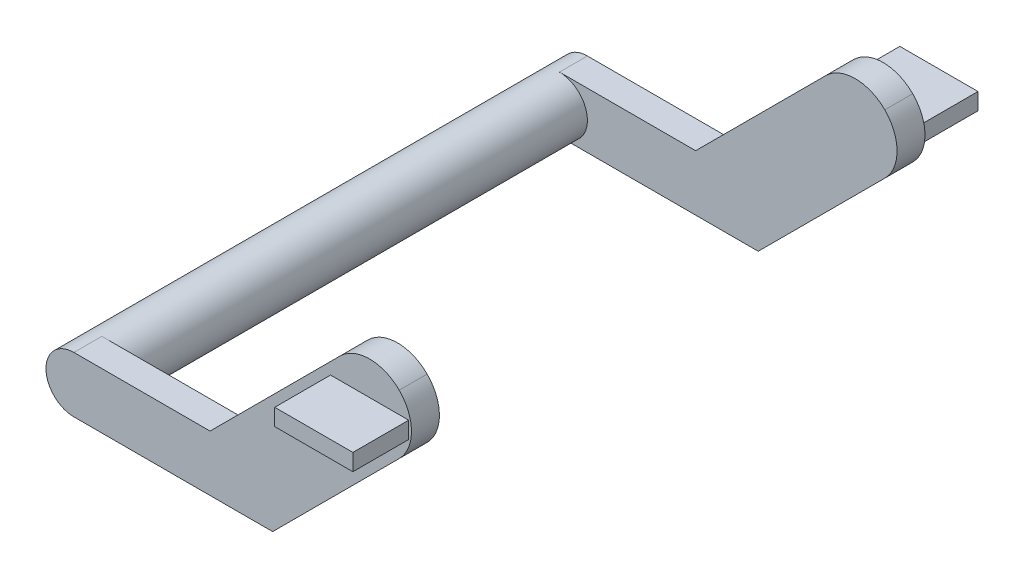
from build123d import *

# Parameters (mm, degrees)
EXTRUDE_1_DEPTH        = 41
EXTRUDE_1_DEPTH_BACK   = 41
SKETCH_1_R             = 5
EXTRUDE_2_DEPTH        = 5
FILLET_1_R             = 7.5
FILLET_1_OF_MIRROR_1_R = 7.5
SKETCH_3_W             = 14
SKETCH_3_H             = 3
EXTRUDE_3_DEPTH        = 10


with BuildPart() as part:
    # 草图1 → 凸台-拉伸1 (new, two sides: drawn at the far end of the back side and taken through both)
    with BuildSketch(Plane.XY.offset(-EXTRUDE_1_DEPTH_BACK)):
        Circle(SKETCH_1_R)
    extrude(amount=EXTRUDE_1_DEPTH + EXTRUDE_1_DEPTH_BACK)

    # 草图2 → 凸台-拉伸2 (add)
    with BuildSketch(Plane.XY.offset(41)):
        with BuildLine():
            Line((0, 5), (24.393398282, 5))
            Line((24.393398282, 5), (52.980970389, 33.587572106))
            Line((52.980970389, 33.587572106), (63.587572106, 22.980970389))
            Line((63.587572106, 22.980970389), (35.606601718, -5))
            Line((35.606601718, -5), (0, -5))
            ThreePointArc((0, -5), (-5, 0), (0, 5))
        make_face()
    extrude_2 = extrude(amount=EXTRUDE_2_DEPTH)

    # 圆角1
    fillet_1_edges = [part.edges().sort_by_distance(p)[0] for p in [
        (63.587572106, 22.980970389, 43.5),
        (52.980970389, 33.587572106, 43.5),
    ]]
    fillet(fillet_1_edges, radius=FILLET_1_R - 0.0001)  # a hair under: the kernel refuses the full size

    # 镜向1: 凸台-拉伸2 across plane
    add(extrude_2.mirror(Plane.XY))

    # 圆角1 of 镜向1
    fillet_1_of_mirror_1_edges = [part.edges().sort_by_distance(p)[0] for p in [
        (63.587572106, 22.980970389, -43.5),
        (52.980970389, 33.587572106, -43.5),
    ]]
    fillet(fillet_1_of_mirror_1_edges, radius=FILLET_1_OF_MIRROR_1_R - 0.0001)  # a hair under: the kernel refuses the full size

    # 草图3 → 凸台-拉伸3 (add)
    with BuildSketch(Plane.XY.offset(46)):
        with Locations((52.980970389, 22.980970389)):
            Rectangle(SKETCH_3_W, SKETCH_3_H)
    extrude_3 = extrude(amount=EXTRUDE_3_DEPTH)

    # 镜向2: 凸台-拉伸3 across plane
    add(extrude_3.mirror(Plane.XY))


solid = part.part
